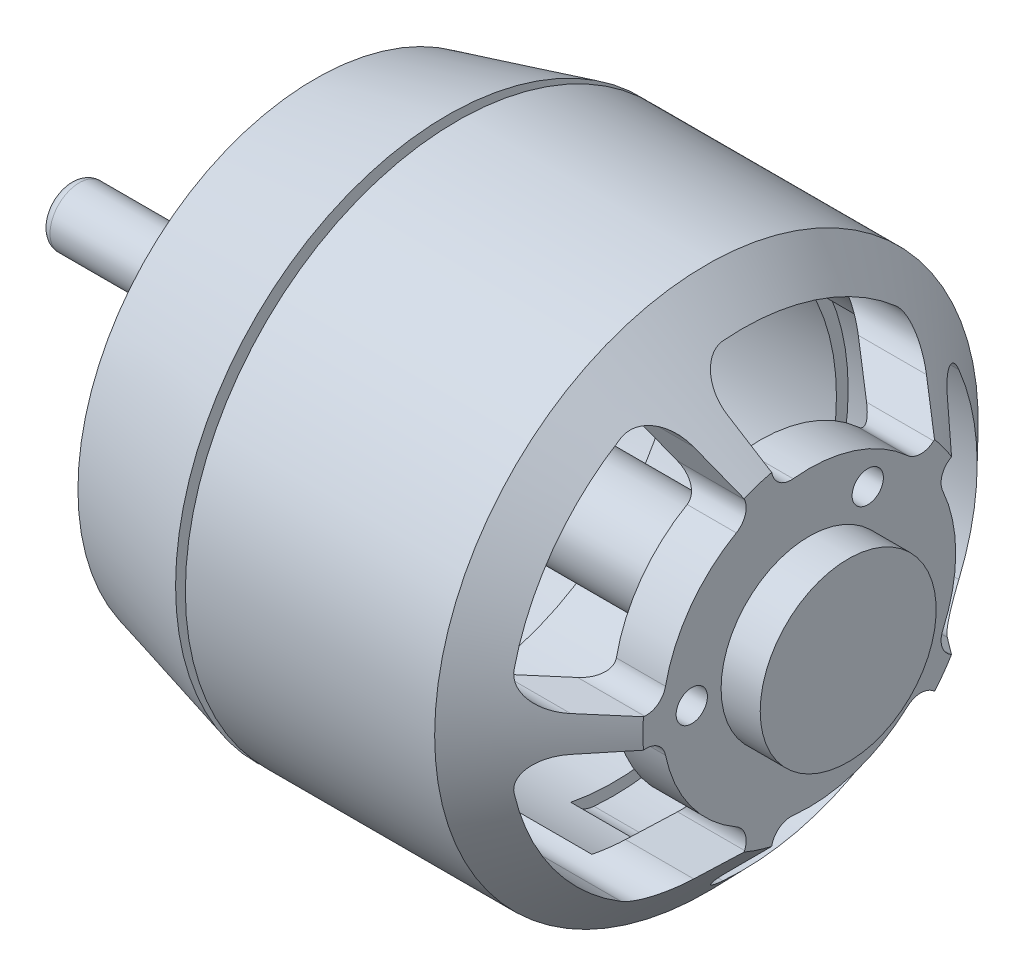
from build123d import *

# Parameters (mm, degrees)
SKETCH2_R          = 2.5
SKETCH2_R_2        = 1.25
CUT_EXTRUDE4_DEPTH = 5
SKETCH3_R          = 0.8
CUT_EXTRUDE5_DEPTH = 10
FILLET1_R          = 0.5
CHAMFER1_SIZE      = 0.700451547
CHAMFER1_SIZE_2    = 0.5


with BuildPart() as part:
    # Sketch1 → Revolve3 (revolve)
    with BuildSketch(Plane(origin=(0, 0, 0), x_dir=(1, 0, 0), z_dir=(0, 1, 0))):
        Polygon((0, 0), (27.75, 0), (27.75, -4.5), (25.75, -4.5), (25.75, -8.5), (20.5, -13.9), (7.75, -13.9), (7.75, -11.4), (19.443780497, -11.4), (23.25, -7.485031368), (23.25, -2.5), (2, -2.5), (2, -11.524137931), (7.25, -12.9), (7.25, -13.9), (0, -12), (0, -1.5), (-12.07, -1.5), (-12.07, 0), align=None)
    revolve(axis=Axis((0, 0, 0), (1, 0, 0)))

    # Sketch2 → Cut-Extrude4 (cut)
    with BuildSketch(Plane(origin=(0, 0, 0), x_dir=(0, 0, -1), z_dir=(1, 0, 0))):
        with Locations((0, 9)):
            Circle(SKETCH2_R)
        with Locations((-9, 0)):
            Circle(SKETCH2_R)
        with Locations((-6.717514421, 6.717514421)):
            Circle(SKETCH2_R_2)
        with Locations((5.659784932, 5.659784932)):
            Circle(SKETCH2_R_2)
        with Locations((-5.656854249, -5.656854249)):
            Circle(SKETCH2_R_2)
        with Locations((0, -9)):
            Circle(SKETCH2_R)
        with Locations((9, 0)):
            Circle(SKETCH2_R)
        with Locations((6.717514421, -6.717514421)):
            Circle(SKETCH2_R_2)
    extrude(amount=CUT_EXTRUDE4_DEPTH, mode=Mode.SUBTRACT)

    # Sketch3 → Cut-Extrude5 (cut)
    with BuildSketch(Plane(origin=(25.75, 0, 0), x_dir=(0, 0, -1), z_dir=(1, 0, 0))):
        with Locations((-6, 0)):
            Circle(SKETCH3_R)
        with Locations((3, 5.196152423)):
            Circle(SKETCH3_R)
        with Locations((3, -5.196152423)):
            Circle(SKETCH3_R)
        with BuildLine():
            Line((6.370482064, 5.537775571), (7.843172027, 6.817965426))
            ThreePointArc((7.843172027, 6.817965426), (8.359080888, 7.952820716), (7.838952553, 9.085748339))
            ThreePointArc((7.838952553, 9.085748339), (3.708203932, 11.412678196), (-1.001376954, 11.958145517))
            ThreePointArc((-1.001376954, 11.958145517), (-2.088087764, 11.347311581), (-2.337759932, 10.125950745))
            Line((-2.337759932, 10.125950745), (-1.89880544, 8.224629955))
            ThreePointArc((-1.89880544, 8.224629955), (-1.503405846, 7.634232498), (-0.815678273, 7.455512655))
            ThreePointArc((-0.815678273, 7.455512655), (2.317627458, 7.132923872), (5.042137972, 5.552192781))
            ThreePointArc((5.042137972, 5.552192781), (5.703570154, 5.292544046), (6.370482064, 5.537775571))
        make_face()
        with BuildLine():
            Line((-8.408851063, 0.735679141), (-10.352758988, 0.905749048))
            ThreePointArc((-10.352758988, 0.905749048), (-11.437189226, 1.520622644), (-11.682314713, 2.742904108))
            ThreePointArc((-11.682314713, 2.742904108), (-9.708203932, 7.053423028), (-6.218690606, 10.26293755))
            ThreePointArc((-6.218690606, 10.26293755), (-4.980483913, 10.407515103), (-4.060597, 9.566167049))
            Line((-4.060597, 9.566167049), (-3.298150323, 7.769955241))
            ThreePointArc((-3.298150323, 7.769955241), (-3.271008396, 7.059903614), (-3.722342803, 6.511080099))
            ThreePointArc((-3.722342803, 6.511080099), (-6.067627458, 4.408389392), (-7.342672341, 1.528123976))
            ThreePointArc((-7.342672341, 1.528123976), (-7.72516452, 0.929283655), (-8.408851063, 0.735679141))
        make_face()
        with BuildLine():
            Line((7.235324763, -4.347421716), (8.907943892, -5.352432681))
            ThreePointArc((8.907943892, -5.352432681), (10.146680017, -5.492401594), (11.06342972, -4.647636263))
            ThreePointArc((11.06342972, -4.647636263), (12, 0), (11.06342972, 4.647636263))
            ThreePointArc((11.06342972, 4.647636263), (10.146680017, 5.492401594), (8.907943892, 5.352432681))
            Line((8.907943892, 5.352432681), (7.235324763, 4.347421716))
            ThreePointArc((7.235324763, 4.347421716), (6.796008609, 3.788931507), (6.838555445, 3.079636249))
            ThreePointArc((6.838555445, 3.079636249), (7.5, 0), (6.838555445, -3.079636249))
            ThreePointArc((6.838555445, -3.079636249), (6.796008609, -3.788931507), (7.235324763, -4.347421716))
        make_face()
        with BuildLine():
            Line((-1.89880544, -8.224629955), (-2.337759932, -10.125950745))
            ThreePointArc((-2.337759932, -10.125950745), (-2.088087764, -11.347311581), (-1.001376954, -11.958145517))
            ThreePointArc((-1.001376954, -11.958145517), (3.708203932, -11.412678196), (7.838952553, -9.085748339))
            ThreePointArc((7.838952553, -9.085748339), (8.359080888, -7.952820716), (7.843172027, -6.817965426))
            Line((7.843172027, -6.817965426), (6.370482064, -5.537775571))
            ThreePointArc((6.370482064, -5.537775571), (5.703570154, -5.292544046), (5.042137972, -5.552192781))
            ThreePointArc((5.042137972, -5.552192781), (2.317627458, -7.132923872), (-0.815678273, -7.455512655))
            ThreePointArc((-0.815678273, -7.455512655), (-1.503405846, -7.634232498), (-1.89880544, -8.224629955))
        make_face()
        with BuildLine():
            Line((-8.408851063, -0.735679141), (-10.352758988, -0.905749048))
            ThreePointArc((-10.352758988, -0.905749048), (-11.437189226, -1.520622644), (-11.682314713, -2.742904108))
            ThreePointArc((-11.682314713, -2.742904108), (-9.708203932, -7.053423028), (-6.218690606, -10.26293755))
            ThreePointArc((-6.218690606, -10.26293755), (-4.980483913, -10.407515103), (-4.060597, -9.566167049))
            Line((-4.060597, -9.566167049), (-3.298150323, -7.769955241))
            ThreePointArc((-3.298150323, -7.769955241), (-3.271008396, -7.059903614), (-3.722342803, -6.511080099))
            ThreePointArc((-3.722342803, -6.511080099), (-6.067627458, -4.408389392), (-7.342672341, -1.528123976))
            ThreePointArc((-7.342672341, -1.528123976), (-7.72516452, -0.929283655), (-8.408851063, -0.735679141))
        make_face()
    extrude(amount=-CUT_EXTRUDE5_DEPTH, mode=Mode.SUBTRACT)

    # Fillet1
    fillet1_edges = [part.edges().sort_by_distance(p)[0] for p in [
        (-12.07, 0, -1.5),
    ]]
    fillet(fillet1_edges, radius=FILLET1_R)

    # Chamfer1
    # the kernel refuses this chamfer: 0.700451547, 0.5 mm, written as the material it takes off along each edge
    with BuildSketch(Plane(origin=(0, 0, 0), x_dir=(0, 0, 1), z_dir=(0, 1, 0))) as chamfer1_piece_1:
        Polygon((12 - CHAMFER1_SIZE, 0), (12 + CHAMFER1_SIZE_2 * 0.253508032395, CHAMFER1_SIZE_2 * 0.967333281507), (12, 0), align=None)
    revolve(axis=Axis((0, 0, 0), (1, 0, 0)), mode=Mode.SUBTRACT)


solid = part.part
